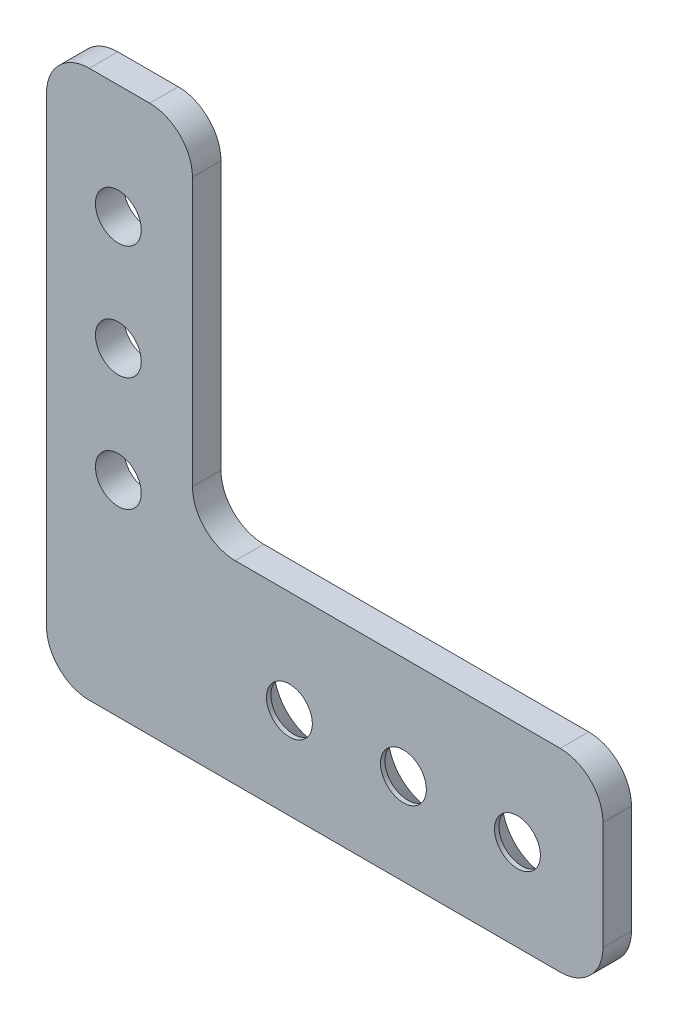
from build123d import *

# Parameters (mm, degrees)
SKETCH1_R                                    = 2.5527
BOSS_EXTRUDE1_DEPTH                          = 3.175
FILLET1_R                                    = 4.7625
CSK_FOR_10_FLAT_HEAD_MACHINE_SCREW3_AT_COUNT = 2
CSK_FOR_10_FLAT_HEAD_MACHINE_SCREW3_AT_PITCH = 12.7
CSK_FOR_10_FLAT_HEAD_MACHINE_SCREW3_2_COUNT  = 2
CSK_FOR_10_FLAT_HEAD_MACHINE_SCREW3_2_PITCH  = 25.4


with BuildPart() as part:
    # Sketch1 → Boss-Extrude1 (new body)
    with BuildSketch(Plane.XY):
        Polygon((-27.051, 31.75), (-27.051, -29.21), (34.925, -29.21), (34.925, -7.62), (-10.795, -7.62), (-10.795, 31.75), align=None)
        with Locations((-19.05, -6.35)):
            Circle(SKETCH1_R, mode=Mode.SUBTRACT)
        with Locations((-19.05, 6.35)):
            Circle(SKETCH1_R, mode=Mode.SUBTRACT)
        with Locations((-19.05, 19.05)):
            Circle(SKETCH1_R, mode=Mode.SUBTRACT)
    extrude(amount=BOSS_EXTRUDE1_DEPTH)

    # Fillet1
    fillet1_edges = [part.edges().sort_by_distance(p)[0] for p in [
        (-27.051, 31.75, 1.5875),
        (-10.795, 31.75, 1.5875),
        (-10.795, -7.62, 1.5875),
        (34.925, -7.62, 1.5875),
        (34.925, -29.21, 1.5875),
        (-27.051, -29.21, 1.5875),
    ]]
    fillet(fillet1_edges, radius=FILLET1_R)

    # Sketch7 → CSK for #10 Flat Head Machine Screw3 (revolve, cut)
    with BuildSketch(Plane(origin=(25.4, -19.05, 0), x_dir=(0, 1, 0), z_dir=(1, 0, 0))):
        Polygon((0, 0), (0, 3.175), (2.5527, 3.175), (2.5527, 2.688180894), (4.8895, 0), align=None)
    csk_for_10_flat_head_machine_screw3 = revolve(axis=Axis((25.4, -19.05, -6.35), (0, 0, 1)), mode=Mode.SUBTRACT)

    # CSK for #10 Flat Head Machine Screw3 at: CSK for #10 Flat Head Machine Screw3 ×2
    with Locations(*[(-i * CSK_FOR_10_FLAT_HEAD_MACHINE_SCREW3_AT_PITCH, 0, 0) for i in range(1, CSK_FOR_10_FLAT_HEAD_MACHINE_SCREW3_AT_COUNT)]):
        add(csk_for_10_flat_head_machine_screw3, mode=Mode.SUBTRACT)

    # CSK for _10 Flat Head Machine Screw3 2: CSK for #10 Flat Head Machine Screw3 ×2
    with Locations(*[(-i * CSK_FOR_10_FLAT_HEAD_MACHINE_SCREW3_2_PITCH, 0, 0) for i in range(1, CSK_FOR_10_FLAT_HEAD_MACHINE_SCREW3_2_COUNT)]):
        add(csk_for_10_flat_head_machine_screw3, mode=Mode.SUBTRACT)


solid = part.part
